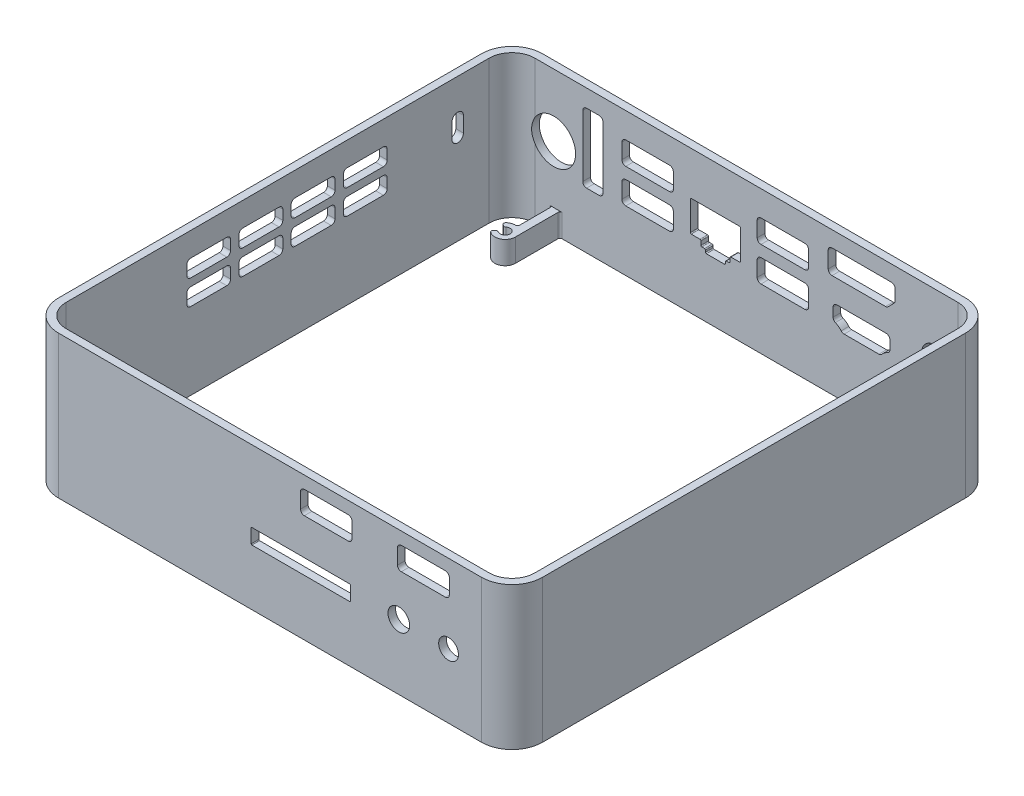
from build123d import *

# Parameters (mm, degrees)
BOSS_EXTRUDE1_DEPTH  = 37.5
CUT_EXTRUDE2_REACH   = 185.478
LPATTERN1_COUNT      = 2
LPATTERN1_PITCH      = 6.5
LPATTERN1_COUNT_DIR2 = 4
LPATTERN1_PITCH_DIR2 = 13.7
CUT_EXTRUDE8_REACH   = 185.478
SKETCH15_R           = 2.85
SKETCH15_R_2         = 2.6
CUT_EXTRUDE5_DEPTH   = 2
CUT_EXTRUDE6_REACH   = 185.478
SKETCH16_R           = 3.5
SKETCH16_R_2         = 5.75
LPATTERN2_START      = -127
LPATTERN2_DEPTH      = 2
BOSS_EXTRUDE2_DEPTH  = 6
CUT_EXTRUDE9_REACH   = 185.478
FILLET1_R            = 0.5


# Read off the part's stored shape, not the designer's step: LPattern2
with BuildPart() as part:
    # Sketch1 → Boss-Extrude1 (new body)
    with BuildSketch(Plane(origin=(0, 0, 0), x_dir=(1, 0, 0), z_dir=(0, 1, 0))):
        with BuildLine():
            Line((8, 0), (119, 0))
            ThreePointArc((119, 0), (124.656854249, 2.343145751), (127, 8))
            Line((127, 8), (127, 119))
            ThreePointArc((127, 119), (124.656854249, 124.656854249), (119, 127))
            Line((119, 127), (8, 127))
            ThreePointArc((8, 127), (2.343145751, 124.656854249), (0, 119))
            Line((0, 119), (0, 8))
            ThreePointArc((0, 8), (2.343145751, 2.343145751), (8, 0))
        make_face()
        with BuildLine():
            Line((2, 8), (2, 119))
            ThreePointArc((2, 119), (3.757359313, 123.242640687), (8, 125))
            Line((8, 125), (119, 125))
            ThreePointArc((119, 125), (123.242640687, 123.242640687), (125, 119))
            Line((125, 119), (125, 8))
            ThreePointArc((125, 8), (123.242640687, 3.757359313), (119, 2))
            Line((119, 2), (8, 2))
            ThreePointArc((8, 2), (3.757359313, 3.757359313), (2, 8))
        make_face(mode=Mode.SUBTRACT)
    extrude(amount=BOSS_EXTRUDE1_DEPTH)

    # Sketch12 → Cut-Extrude2 (cut, up to next)
    with BuildSketch(Plane(origin=(0, 0, 0), x_dir=(0, 0, -1), z_dir=(1, 0, 0)), mode=Mode.PRIVATE) as cut_extrude2_sk1:
        with BuildLine():
            Line((40.65, 31.2), (50.15, 31.2))
            ThreePointArc((50.15, 31.2), (50.857106781, 30.907106781), (51.15, 30.2))
            Line((51.15, 30.2), (51.15, 27.7))
            ThreePointArc((51.15, 27.7), (50.857106781, 26.992893219), (50.15, 26.7))
            Line((50.15, 26.7), (40.65, 26.7))
            ThreePointArc((40.65, 26.7), (39.942893219, 26.992893219), (39.65, 27.7))
            Line((39.65, 27.7), (39.65, 30.2))
            ThreePointArc((39.65, 30.2), (39.942893219, 30.907106781), (40.65, 31.2))
        make_face()
    cut_extrude2_tool1 = extrude(cut_extrude2_sk1.sketch, amount=CUT_EXTRUDE2_REACH, mode=Mode.PRIVATE) & part.part
    cut_extrude2 = cut_extrude2_tool1.solids().sort_by_distance((0, 28.95, -45.4))[0]
    add(cut_extrude2, mode=Mode.SUBTRACT)

    # LPattern1: Cut-Extrude2 2 × 4
    with Locations(*[(0, -i * LPATTERN1_PITCH, -j * LPATTERN1_PITCH_DIR2) for i in range(LPATTERN1_COUNT) for j in range(LPATTERN1_COUNT_DIR2) if (i, j) != (0, 0)]):
        add(cut_extrude2, mode=Mode.SUBTRACT)

    # Sketch18 → Cut-Extrude8 (cut, up to next)
    with BuildSketch(Plane.ZY, mode=Mode.PRIVATE) as cut_extrude8_sk1:
        with BuildLine():
            Line((-112.25, 23.85), (-112.25, 27.85))
            ThreePointArc((-112.25, 27.85), (-110.75, 29.35), (-109.25, 27.85))
            Line((-109.25, 27.85), (-109.25, 23.85))
            ThreePointArc((-109.25, 23.85), (-110.75, 22.35), (-112.25, 23.85))
        make_face()
    cut_extrude8_tool1 = extrude(cut_extrude8_sk1.sketch, amount=-CUT_EXTRUDE8_REACH, mode=Mode.PRIVATE) & part.part
    add(cut_extrude8_tool1.solids().sort_by_distance((0, 25.85, -110.75))[0], mode=Mode.SUBTRACT)

    # Sketch15 → Cut-Extrude5 (cut)
    with BuildSketch(Plane.XY):
        with Locations((97.3, 17.1)):
            Circle(SKETCH15_R)
        with Locations((110.35, 16.9)):
            Circle(SKETCH15_R_2)
        with BuildLine():
            Line((84.45, 18.7), (58.75, 18.7))
            ThreePointArc((58.75, 18.7), (58.608578644, 18.641421356), (58.55, 18.5))
            Line((58.55, 18.5), (58.55, 14.9))
            ThreePointArc((58.55, 14.9), (58.608578644, 14.758578644), (58.75, 14.7))
            Line((58.75, 14.7), (84.45, 14.7))
            ThreePointArc((84.45, 14.7), (84.591421356, 14.758578644), (84.65, 14.9))
            Line((84.65, 14.9), (84.65, 18.5))
            ThreePointArc((84.65, 18.5), (84.591421356, 18.641421356), (84.45, 18.7))
        make_face()
        with BuildLine():
            Line((72.5, 34.25), (84, 34.25))
            ThreePointArc((84, 34.25), (84.707106781, 33.957106781), (85, 33.25))
            Line((85, 33.25), (85, 29.25))
            ThreePointArc((85, 29.25), (84.707106781, 28.542893219), (84, 28.25))
            Line((84, 28.25), (72.5, 28.25))
            ThreePointArc((72.5, 28.25), (71.792893219, 28.542893219), (71.5, 29.25))
            Line((71.5, 29.25), (71.5, 33.25))
            ThreePointArc((71.5, 33.25), (71.792893219, 33.957106781), (72.5, 34.25))
        make_face()
        with BuildLine():
            Line((97.95, 34.25), (109.55, 34.25))
            ThreePointArc((109.55, 34.25), (110.257106781, 33.957106781), (110.55, 33.25))
            Line((110.55, 33.25), (110.55, 29.25))
            ThreePointArc((110.55, 29.25), (110.257106781, 28.542893219), (109.55, 28.25))
            Line((109.55, 28.25), (97.95, 28.25))
            ThreePointArc((97.95, 28.25), (97.242893219, 28.542893219), (96.95, 29.25))
            Line((96.95, 29.25), (96.95, 33.25))
            ThreePointArc((96.95, 33.25), (97.242893219, 33.957106781), (97.95, 34.25))
        make_face()
    extrude(amount=-CUT_EXTRUDE5_DEPTH, mode=Mode.SUBTRACT)

    # Sketch16 → Cut-Extrude6 (cut, up to next)
    with BuildSketch(Plane(origin=(0, 0, -127), x_dir=(-1, 0, 0), z_dir=(0, 0, -1)), mode=Mode.PRIVATE) as cut_extrude6_sk1:
        with Locations((-113.005099646, 21.321346632)):
            Circle(SKETCH16_R)
    cut_extrude6_tool1 = extrude(cut_extrude6_sk1.sketch, amount=-CUT_EXTRUDE6_REACH, mode=Mode.PRIVATE) & part.part
    # Sketch16 → Cut-Extrude6 (cut, up to next)
    with BuildSketch(Plane(origin=(0, 0, -127), x_dir=(-1, 0, 0), z_dir=(0, 0, -1)), mode=Mode.PRIVATE) as cut_extrude6_sk2:
        with Locations(Location((-12.945962095, 21.055591298, 0), (0, 0, 30.664625138))):
            Circle(SKETCH16_R_2)
    cut_extrude6_tool2 = extrude(cut_extrude6_sk2.sketch, amount=-CUT_EXTRUDE6_REACH, mode=Mode.PRIVATE) & part.part
    # Sketch16 → Cut-Extrude6 (cut, up to next)
    with BuildSketch(Plane(origin=(0, 0, -127), x_dir=(-1, 0, 0), z_dir=(0, 0, -1)), mode=Mode.PRIVATE) as cut_extrude6_sk3:
        with BuildLine():
            Line((-100.161964347, 21.055591298), (-87.261964347, 21.055591298))
            ThreePointArc((-87.261964347, 21.055591298), (-86.554857566, 20.762698079), (-86.261964347, 20.055591298))
            Line((-86.261964347, 20.055591298), (-86.261964347, 17.748541334))
            ThreePointArc((-86.261964347, 17.748541334), (-86.426497599, 17.199000332), (-86.865954973, 16.830294866))
            ThreePointArc((-86.865954973, 16.830294866), (-87.693874872, 16.355098079), (-88.393104173, 15.705219837))
            ThreePointArc((-88.393104173, 15.705219837), (-88.734612535, 15.447193956), (-89.152720499, 15.355591298))
            Line((-89.152720499, 15.355591298), (-98.271208195, 15.355591298))
            ThreePointArc((-98.271208195, 15.355591298), (-98.689316159, 15.447193956), (-99.030824521, 15.705219837))
            ThreePointArc((-99.030824521, 15.705219837), (-99.730053822, 16.355098079), (-100.557973721, 16.830294866))
            ThreePointArc((-100.557973721, 16.830294866), (-100.997431095, 17.199000332), (-101.161964347, 17.748541334))
            Line((-101.161964347, 17.748541334), (-101.161964347, 20.055591298))
            ThreePointArc((-101.161964347, 20.055591298), (-100.869071128, 20.762698079), (-100.161964347, 21.055591298))
        make_face()
    cut_extrude6_tool3 = extrude(cut_extrude6_sk3.sketch, amount=-CUT_EXTRUDE6_REACH, mode=Mode.PRIVATE) & part.part
    # Sketch16 → Cut-Extrude6 (cut, up to next)
    with BuildSketch(Plane(origin=(0, 0, -127), x_dir=(-1, 0, 0), z_dir=(0, 0, -1)), mode=Mode.PRIVATE) as cut_extrude6_sk4:
        with BuildLine():
            Line((-101.548332774, 33.349261432), (-85.97871797, 33.349261432))
            ThreePointArc((-85.97871797, 33.349261432), (-85.271611189, 33.056368213), (-84.97871797, 32.349261432))
            Line((-84.97871797, 32.349261432), (-84.97871797, 28.068196502))
            ThreePointArc((-84.97871797, 28.068196502), (-85.271611189, 27.361089721), (-85.97871797, 27.068196502))
            Line((-85.97871797, 27.068196502), (-100.024010827, 27.068196502))
            ThreePointArc((-100.024010827, 27.068196502), (-100.410706716, 27.14598921), (-100.737238364, 27.367263923))
            Line((-100.737238364, 27.367263923), (-102.26156031, 28.91832378))
            ThreePointArc((-102.26156031, 28.91832378), (-102.473867089, 29.240592615), (-102.548332774, 29.61925636))
            Line((-102.548332774, 29.61925636), (-102.548332774, 32.349261432))
            ThreePointArc((-102.548332774, 32.349261432), (-102.255439555, 33.056368213), (-101.548332774, 33.349261432))
        make_face()
    cut_extrude6_tool4 = extrude(cut_extrude6_sk4.sketch, amount=-CUT_EXTRUDE6_REACH, mode=Mode.PRIVATE) & part.part
    # Sketch16 → Cut-Extrude6 (cut, up to next)
    with BuildSketch(Plane(origin=(0, 0, -127), x_dir=(-1, 0, 0), z_dir=(0, 0, -1)), mode=Mode.PRIVATE) as cut_extrude6_sk5:
        with BuildLine():
            Line((-78.841935003, 30.831196784), (-67.341935003, 30.831196784))
            ThreePointArc((-67.341935003, 30.831196784), (-66.634828222, 30.538303565), (-66.341935003, 29.831196784))
            Line((-66.341935003, 29.831196784), (-66.341935003, 25.831196784))
            ThreePointArc((-66.341935003, 25.831196784), (-66.634828222, 25.124090003), (-67.341935003, 24.831196784))
            Line((-67.341935003, 24.831196784), (-78.841935003, 24.831196784))
            ThreePointArc((-78.841935003, 24.831196784), (-79.549041784, 25.124090003), (-79.841935003, 25.831196784))
            Line((-79.841935003, 25.831196784), (-79.841935003, 29.831196784))
            ThreePointArc((-79.841935003, 29.831196784), (-79.549041784, 30.538303565), (-78.841935003, 30.831196784))
        make_face()
    cut_extrude6_tool5 = extrude(cut_extrude6_sk5.sketch, amount=-CUT_EXTRUDE6_REACH, mode=Mode.PRIVATE) & part.part
    # Sketch16 → Cut-Extrude6 (cut, up to next)
    with BuildSketch(Plane(origin=(0, 0, -127), x_dir=(-1, 0, 0), z_dir=(0, 0, -1)), mode=Mode.PRIVATE) as cut_extrude6_sk6:
        with BuildLine():
            Line((-24.866141581, 32.901546086), (-21.574861336, 32.901546086))
            ThreePointArc((-21.574861336, 32.901546086), (-20.867754555, 32.608652868), (-20.574861336, 31.901546086))
            Line((-20.574861336, 31.901546086), (-20.574861336, 15.737449724))
            ThreePointArc((-20.574861336, 15.737449724), (-20.867754555, 15.030342943), (-21.574861336, 14.737449724))
            Line((-21.574861336, 14.737449724), (-24.866141581, 14.737449724))
            ThreePointArc((-24.866141581, 14.737449724), (-25.573248362, 15.030342943), (-25.866141581, 15.737449724))
            Line((-25.866141581, 15.737449724), (-25.866141581, 31.901546086))
            ThreePointArc((-25.866141581, 31.901546086), (-25.573248362, 32.608652868), (-24.866141581, 32.901546086))
        make_face()
    cut_extrude6_tool6 = extrude(cut_extrude6_sk6.sketch, amount=-CUT_EXTRUDE6_REACH, mode=Mode.PRIVATE) & part.part
    # Sketch16 → Cut-Extrude6 (cut, up to next)
    with BuildSketch(Plane(origin=(0, 0, -127), x_dir=(-1, 0, 0), z_dir=(0, 0, -1)), mode=Mode.PRIVATE) as cut_extrude6_sk7:
        with BuildLine():
            Line((-61.735958743, 26.13669488), (-49.037049372, 26.13669488))
            ThreePointArc((-49.037049372, 26.13669488), (-48.860272677, 26.063471576), (-48.787049372, 25.88669488))
            Line((-48.787049372, 25.88669488), (-48.787049372, 18.254361298))
            ThreePointArc((-48.787049372, 18.254361298), (-48.860272677, 18.077584603), (-49.037049372, 18.004361298))
            Line((-49.037049372, 18.004361298), (-51.331962238, 18.004361298))
            ThreePointArc((-51.331962238, 18.004361298), (-51.508738934, 17.931137993), (-51.581962238, 17.754361298))
            Line((-51.581962238, 17.754361298), (-51.581962238, 16.75465245))
            ThreePointArc((-51.581962238, 16.75465245), (-51.655185543, 16.577875755), (-51.831962238, 16.50465245))
            Line((-51.831962238, 16.50465245), (-52.520520549, 16.50465245))
            ThreePointArc((-52.520520549, 16.50465245), (-52.697297244, 16.431429145), (-52.770520549, 16.25465245))
            Line((-52.770520549, 16.25465245), (-52.770520549, 15.78914939))
            ThreePointArc((-52.770520549, 15.78914939), (-52.843743853, 15.612372695), (-53.020520549, 15.53914939))
            Line((-53.020520549, 15.53914939), (-57.752487566, 15.53914939))
            ThreePointArc((-57.752487566, 15.53914939), (-57.929264261, 15.612372695), (-58.002487566, 15.78914939))
            Line((-58.002487566, 15.78914939), (-58.002487566, 16.25465245))
            ThreePointArc((-58.002487566, 16.25465245), (-58.075710871, 16.431429145), (-58.252487566, 16.50465245))
            Line((-58.252487566, 16.50465245), (-58.941045877, 16.50465245))
            ThreePointArc((-58.941045877, 16.50465245), (-59.117822572, 16.577875755), (-59.191045877, 16.75465245))
            Line((-59.191045877, 16.75465245), (-59.191045877, 17.754361298))
            ThreePointArc((-59.191045877, 17.754361298), (-59.264269181, 17.931137993), (-59.441045877, 18.004361298))
            Line((-59.441045877, 18.004361298), (-61.735958743, 18.004361298))
            ThreePointArc((-61.735958743, 18.004361298), (-61.912735438, 18.077584603), (-61.985958743, 18.254361298))
            Line((-61.985958743, 18.254361298), (-61.985958743, 25.88669488))
            ThreePointArc((-61.985958743, 25.88669488), (-61.912735438, 26.063471576), (-61.735958743, 26.13669488))
        make_face()
    cut_extrude6_tool7 = extrude(cut_extrude6_sk7.sketch, amount=-CUT_EXTRUDE6_REACH, mode=Mode.PRIVATE) & part.part
    add(cut_extrude6_tool1.solids().sort_by_distance((113.0051, 21.321347, -127))[0], mode=Mode.SUBTRACT)
    add(cut_extrude6_tool2.solids().sort_by_distance((12.945962, 21.055591, -127))[0], mode=Mode.SUBTRACT)
    add(cut_extrude6_tool3.solids().sort_by_distance((93.711964, 18.337861, -127))[0], mode=Mode.SUBTRACT)
    add(cut_extrude6_tool4.solids().sort_by_distance((93.607916, 30.254656, -127))[0], mode=Mode.SUBTRACT)
    add(cut_extrude6_tool5.solids().sort_by_distance((73.091935, 27.831197, -127))[0], mode=Mode.SUBTRACT)
    add(cut_extrude6_tool6.solids().sort_by_distance((23.220501, 23.819498, -127))[0], mode=Mode.SUBTRACT)
    add(cut_extrude6_tool7.solids().sort_by_distance((55.386504, 21.379991, -127))[0], mode=Mode.SUBTRACT)

    # LPattern2 outline → LPattern2 (cut)
    with BuildSketch(Plane.XY.offset(LPATTERN2_START)):
        with BuildLine():
            ThreePointArc((43.341935003, 15.831196784), (44.049041784, 16.124090003), (44.341935003, 16.831196784))
            Line((44.341935003, 16.831196784), (44.341935003, 20.831196784))
            ThreePointArc((44.341935003, 20.831196784), (44.049041784, 21.538303565), (43.341935003, 21.831196784))
            Line((43.341935003, 21.831196784), (31.841935003, 21.831196784))
            ThreePointArc((31.841935003, 21.831196784), (31.134828222, 21.538303565), (30.841935003, 20.831196784))
            Line((30.841935003, 20.831196784), (30.841935003, 16.831196784))
            ThreePointArc((30.841935003, 16.831196784), (31.134828222, 16.124090003), (31.841935003, 15.831196784))
            Line((31.841935003, 15.831196784), (43.341935003, 15.831196784))
        make_face()
        with BuildLine():
            ThreePointArc((43.341935003, 24.831196784), (44.049041784, 25.124090003), (44.341935003, 25.831196784))
            Line((44.341935003, 25.831196784), (44.341935003, 29.831196784))
            ThreePointArc((44.341935003, 29.831196784), (44.049041784, 30.538303565), (43.341935003, 30.831196784))
            Line((43.341935003, 30.831196784), (31.841935003, 30.831196784))
            ThreePointArc((31.841935003, 30.831196784), (31.134828222, 30.538303565), (30.841935003, 29.831196784))
            Line((30.841935003, 29.831196784), (30.841935003, 25.831196784))
            ThreePointArc((30.841935003, 25.831196784), (31.134828222, 25.124090003), (31.841935003, 24.831196784))
            Line((31.841935003, 24.831196784), (43.341935003, 24.831196784))
        make_face()
        with BuildLine():
            ThreePointArc((79.841935003, 20.831196784), (79.549041784, 21.538303565), (78.841935003, 21.831196784))
            Line((78.841935003, 21.831196784), (67.341935003, 21.831196784))
            ThreePointArc((67.341935003, 21.831196784), (66.634828222, 21.538303565), (66.341935003, 20.831196784))
            Line((66.341935003, 20.831196784), (66.341935003, 16.831196784))
            ThreePointArc((66.341935003, 16.831196784), (66.634828222, 16.124090003), (67.341935003, 15.831196784))
            Line((67.341935003, 15.831196784), (78.841935003, 15.831196784))
            ThreePointArc((78.841935003, 15.831196784), (79.549041784, 16.124090003), (79.841935003, 16.831196784))
            Line((79.841935003, 16.831196784), (79.841935003, 20.831196784))
        make_face()
    extrude(amount=LPATTERN2_DEPTH, mode=Mode.SUBTRACT)

    # Sketch19 → Boss-Extrude2 (add)
    with BuildSketch(Plane.XZ):
        with BuildLine():
            Line((2, -8), (2, -119))
            ThreePointArc((2, -119), (3.757359313, -123.242640687), (8, -125))
            Line((8, -125), (119, -125))
            ThreePointArc((119, -125), (123.242640687, -123.242640687), (125, -119))
            Line((125, -119), (125, -8))
            ThreePointArc((125, -8), (123.242640687, -3.757359313), (119, -2))
            Line((119, -2), (8, -2))
            ThreePointArc((8, -2), (3.757359313, -3.757359313), (2, -8))
        make_face()
    extrude(amount=-BOSS_EXTRUDE2_DEPTH)

    # Sketch20 → Cut-Extrude9 (cut, up to next)
    with BuildSketch(Plane.XZ, mode=Mode.PRIVATE) as cut_extrude9_sk1:
        with BuildLine():
            Line((5.287520961, -11.936592753), (8.828165552, -12.578009993))
            ThreePointArc((8.828165552, -12.578009993), (10.924566558, -10.742188298), (13.527388211, -11.737405822))
            Line((13.527388211, -11.737405822), (12.424298027, -12.599491692))
            ThreePointArc((12.424298027, -12.599491692), (10.100026812, -13.40834935), (12.434495964, -14.187285273))
            Line((12.434495964, -14.187285273), (13.54856854, -15.035130952))
            ThreePointArc((13.54856854, -15.035130952), (10.891354243, -16.051655991), (8.798891003, -14.124038664))
            Line((8.798891003, -14.124038664), (2, -14.289417089))
            Line((2, -14.289417089), (2, -119))
            ThreePointArc((2, -119), (3.757359313, -123.242640687), (8, -125))
            Line((8, -125), (12.473487724, -125))
            Line((12.473487724, -125), (12.473487724, -115.938391902))
            ThreePointArc((12.473487724, -115.938391902), (10.915895942, -115.814267131), (9.687891155, -114.848087355))
            Line((9.687891155, -114.848087355), (10.834910556, -114.045375393))
            ThreePointArc((10.834910556, -114.045375393), (13.198976977, -113.351563693), (10.89734506, -112.472544218))
            Line((10.89734506, -112.472544218), (9.817562817, -111.581437991))
            ThreePointArc((9.817562817, -111.581437991), (12.813077107, -110.759076901), (14.6, -113.3))
            Line((14.6, -113.3), (14.6, -125))
            Line((14.6, -125), (119, -125))
            ThreePointArc((119, -125), (123.242640687, -123.242640687), (125, -119))
            Line((125, -119), (125, -13.69559507))
            Line((125, -13.69559507), (117.708859425, -13.69559507))
            ThreePointArc((117.708859425, -13.69559507), (115.504479221, -15.66953115), (112.814295851, -14.43720442))
            Line((112.814295851, -14.43720442), (113.99947578, -13.691987313))
            ThreePointArc((113.99947578, -13.691987313), (116.399978377, -13.007497931), (114.007531133, -12.295364084))
            Line((114.007531133, -12.295364084), (112.831026199, -11.536525405))
            ThreePointArc((112.831026199, -11.536525405), (115.307535357, -10.307987913), (117.566476803, -11.90159562))
            Line((117.566476803, -11.90159562), (125, -11.90159562))
            Line((125, -11.90159562), (125, -8))
            ThreePointArc((125, -8), (123.242640687, -3.757359313), (119, -2))
            Line((119, -2), (8, -2))
            ThreePointArc((8, -2), (3.757359313, -3.757359313), (2, -8))
            ThreePointArc((2, -8), (2.92996704, -10.564398398), (5.287520961, -11.936592753))
        make_face()
    cut_extrude9_tool1 = extrude(cut_extrude9_sk1.sketch, amount=-CUT_EXTRUDE9_REACH, mode=Mode.PRIVATE) & part.part
    add(cut_extrude9_tool1.solids().sort_by_distance((63.633204, 0, -63.573536))[0], mode=Mode.SUBTRACT)

    # Fillet1
    fillet1_edges = [part.edges().sort_by_distance(p)[0] for p in [
        (2, 3, -14.289417089),
        (8.798891003, 3, -14.124038664),
        (13.54856854, 3, -15.035130952),
        (12.434495964, 3, -14.187285273),
        (12.424298027, 3, -12.599491692),
        (13.527388211, 3, -11.737405822),
        (8.828165552, 3, -12.578009993),
        (125, 3, -11.90159562),
        (117.566476803, 3, -11.90159562),
        (112.831026199, 3, -11.536525405),
        (114.007531133, 3, -12.295364084),
        (113.99947578, 3, -13.691987313),
        (112.814295851, 3, -14.43720442),
        (117.708859425, 3, -13.69559507),
        (125, 3, -13.69559507),
        (14.6, 3, -125),
        (9.817562817, 3, -111.581437991),
        (10.89734506, 3, -112.472544218),
        (10.834910556, 3, -114.045375393),
        (9.687891155, 3, -114.848087355),
        (12.473487724, 3, -115.938391902),
        (12.473487724, 3, -125),
    ]]
    fillet(fillet1_edges, radius=FILLET1_R)


solid = part.part
